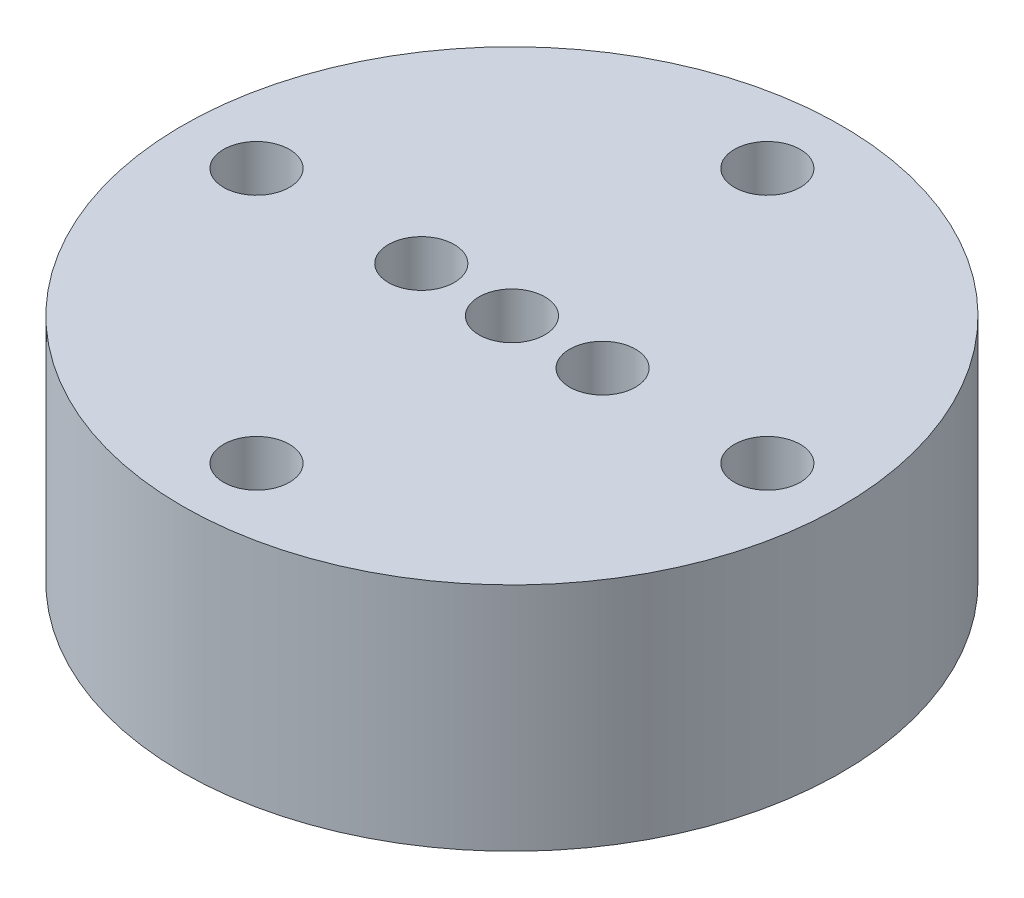
from build123d import *

# Parameters (mm, degrees)
SKETCH1_R           = 20
SKETCH1_R_2         = 2
BOSS_EXTRUDE1_DEPTH = 14
SKETCH2_R           = 2
CUT_EXTRUDE1_DEPTH  = 32.559467676


with BuildPart() as part:
    # Sketch1 → Boss-Extrude1 (new body)
    with BuildSketch(Plane(origin=(0, 0, 0), x_dir=(1, 0, 0), z_dir=(0, 1, 0))):
        Circle(SKETCH1_R)
        with Locations((0, 15.5)):
            Circle(SKETCH1_R_2, mode=Mode.SUBTRACT)
        with Locations((15.5, 0)):
            Circle(SKETCH1_R_2, mode=Mode.SUBTRACT)
        with Locations((0, -15.5)):
            Circle(SKETCH1_R_2, mode=Mode.SUBTRACT)
        with Locations((-15.5, 0)):
            Circle(SKETCH1_R_2, mode=Mode.SUBTRACT)
    extrude(amount=BOSS_EXTRUDE1_DEPTH)

    # Sketch2 → Cut-Extrude1 (cut, through all)
    with BuildSketch(Plane(origin=(0, 14, 0), x_dir=(1, 0, 0), z_dir=(0, 1, 0))):
        Circle(SKETCH2_R)
        with Locations((5.5, 0)):
            Circle(SKETCH2_R)
        with Locations((-5.5, 0)):
            Circle(SKETCH2_R)
    extrude(amount=-CUT_EXTRUDE1_DEPTH, mode=Mode.SUBTRACT)


solid = part.part
